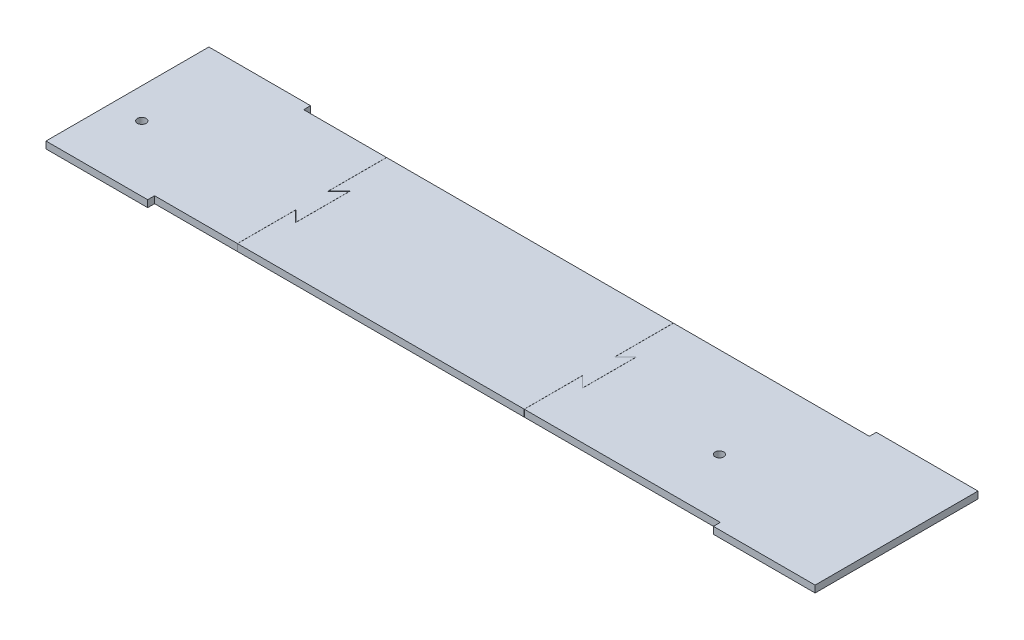
from build123d import *

# Parameters (mm, degrees)
BOSS_EXTRUDE1_DEPTH  = 3.175
SKETCH4_R            = 4
LEFT_AND_RIGHT_DEPTH = 363.060140032


with BuildPart() as part:
    # Sketch1 → Boss-Extrude1 (new, symmetric)
    with BuildSketch(Plane(origin=(0, 0, 0), x_dir=(1, 0, 0), z_dir=(0, 1, 0))):
        Polygon((-354.15, 75), (-354.15, -75), (-260.5, -75), (-260.5, -68.65), (260.5, -68.65), (260.5, -75), (354.15, -75), (354.15, 75), (260.5, 75), (260.5, 68.65), (-260.5, 68.65), (-260.5, 75), align=None)
    extrude(amount=BOSS_EXTRUDE1_DEPTH, both=True)

    # Sketch4 → Left and Right (cut, through all)
    with BuildSketch(Plane.XZ.offset(3.175)):
        with Locations((-326.1, 14.85)):
            Circle(SKETCH4_R)
        with Locations((205.9, 14.85)):
            Circle(SKETCH4_R)
        Polygon((-184.15, -68.65), (-184.15, -15), (-174.15, -25), (-174.15, 25), (-184.15, 15), (-184.15, 68.65), (-184.25, 68.65), (-184.25, 14.758578644), (-174.25, 24.758578644), (-174.25, -24.758578644), (-184.25, -14.758578644), (-184.25, -68.65), align=None)
        Polygon((80, -68.65), (80, -15), (90, -25), (90, 25), (80, 15), (80, 68.65), (79.9, 68.65), (79.9, 14.758578644), (89.9, 24.758578644), (89.9, -24.758578644), (79.9, -14.758578644), (79.9, -68.65), align=None)
    extrude(amount=-LEFT_AND_RIGHT_DEPTH, mode=Mode.SUBTRACT)


with BuildPart() as left_and_right_piece_1:
    # of the separate pieces the step leaves, piece 1, a body of its own (left_and_right_pieces)
    add(part.part.solids().sort_by_distance((260.5, -3.175, -68.65))[0])


with BuildPart() as left_and_right_piece_2:
    # of the separate pieces the step leaves, piece 2, a body of its own (left_and_right_pieces)
    add(part.part.solids().sort_by_distance((79.9, -3.175, -68.65))[0])


with BuildPart() as left_and_right_piece_3:
    # of the separate pieces the step leaves, piece 3, a body of its own (left_and_right_pieces)
    add(part.part.solids().sort_by_distance((-354.15, -3.175, -75))[0])


solid = Compound([left_and_right_piece_1.part, left_and_right_piece_2.part, left_and_right_piece_3.part])
